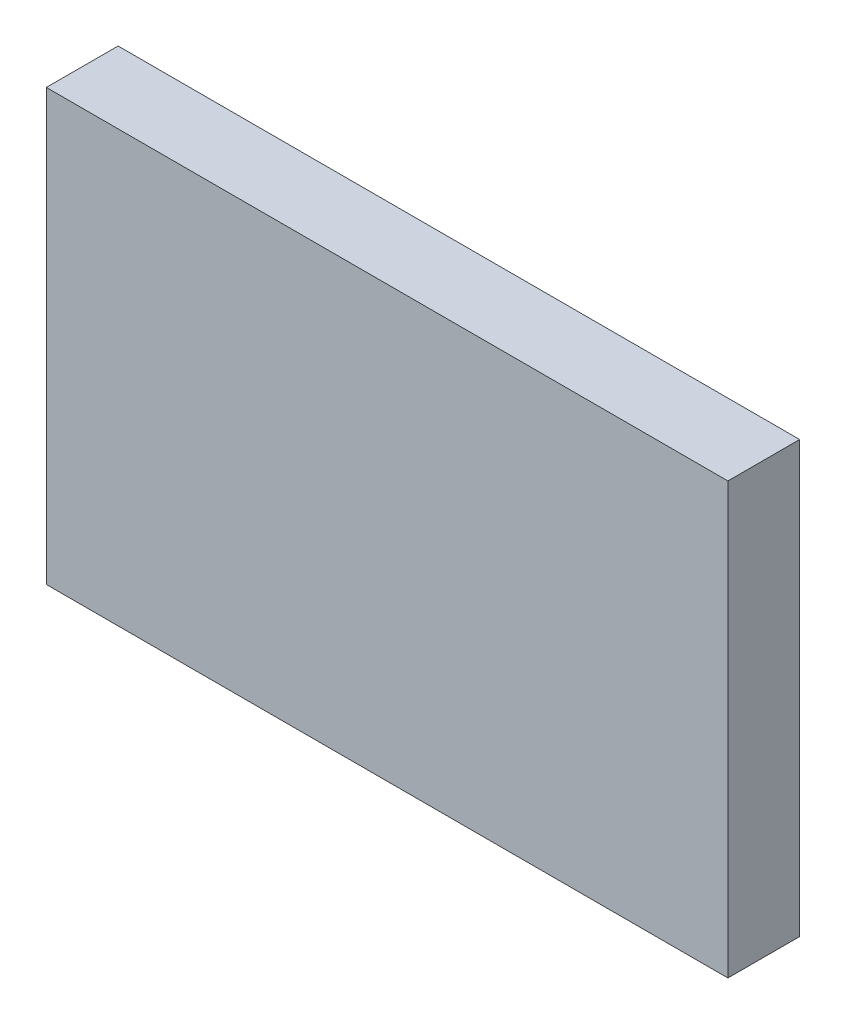
from build123d import *

# Parameters (mm, degrees)
SKETCH1_W           = 120.65
SKETCH1_H           = 76.2
BOSS_EXTRUDE1_DEPTH = 12.7


with BuildPart() as part:
    # Sketch1 → Boss-Extrude1 (new body)
    with BuildSketch(Plane.XY):
        Rectangle(SKETCH1_W, SKETCH1_H)
    extrude(amount=BOSS_EXTRUDE1_DEPTH)


solid = part.part
